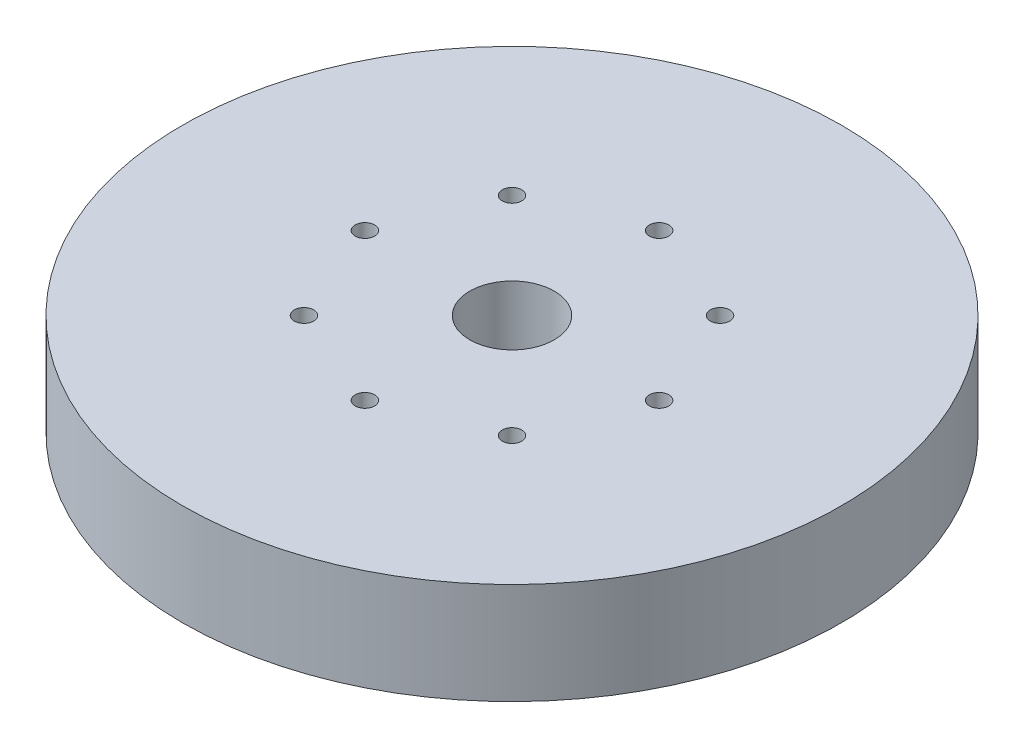
from build123d import *

# Parameters (mm, degrees)
SKETCH1_R           = 97.5
BOSS_EXTRUDE1_DEPTH = 30
SKETCH2_R           = 12.5
CUT_EXTRUDE1_DEPTH  = 142.111657917
SKETCH3_R           = 2.875712839
CUT_EXTRUDE2_DEPTH  = 22.585890954
CIRPATTERN1_COUNT   = 8


with BuildPart() as part:
    # Sketch1 → Boss-Extrude1 (new body)
    with BuildSketch(Plane(origin=(0, 0, 0), x_dir=(1, 0, 0), z_dir=(0, 1, 0))):
        Circle(SKETCH1_R)
    extrude(amount=BOSS_EXTRUDE1_DEPTH)

    # Sketch2 → Cut-Extrude1 (cut, through all)
    with BuildSketch(Plane(origin=(0, 0, 0), x_dir=(1, 0, 0), z_dir=(0, 1, 0))):
        Circle(SKETCH2_R)
    extrude(amount=CUT_EXTRUDE1_DEPTH, mode=Mode.SUBTRACT)

    # Sketch3 → Cut-Extrude2 (cut)
    with BuildSketch(Plane(origin=(0, 30, 0), x_dir=(1, 0, 0), z_dir=(0, 1, 0))):
        with Locations((-43.522159415, 0)):
            Circle(SKETCH3_R)
    cut_extrude2 = extrude(amount=-CUT_EXTRUDE2_DEPTH, mode=Mode.SUBTRACT)

    # CirPattern1: Cut-Extrude2 ×8 about axis
    cirpattern1_axis = Axis((0, 0, 0), (0, 1, 0))
    for i in range(1, CIRPATTERN1_COUNT):
        add(cut_extrude2.rotate(cirpattern1_axis, i * 360 / CIRPATTERN1_COUNT), mode=Mode.SUBTRACT)


solid = part.part
